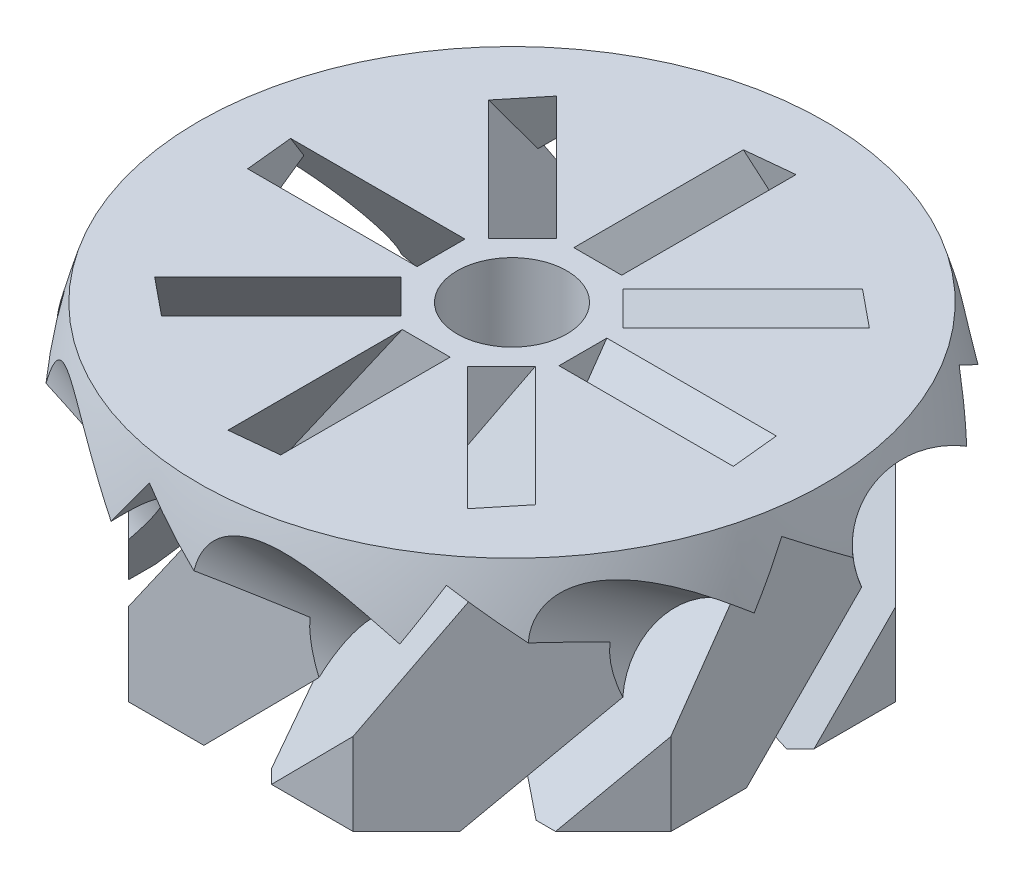
from build123d import *

# Parameters (mm, degrees)
BOSS_EXTRUDE1_DEPTH      = 20
BOSS_EXTRUDE1_DEPTH_BACK = 14
SKETCH1_R                = 45
CUT_EXTRUDE1_DEPTH       = 5
CIRPATTERN1_COUNT        = 8
SKETCH14_W               = 28.71512873
SKETCH14_H               = 59.277326168
CUT_EXTRUDE2_DEPTH       = 77.076617289
CIRPATTERN2_COUNT        = 8
SKETCH15_R               = 9
CUT_EXTRUDE3_DEPTH       = 73.506990997
CIRPATTERN3_COUNT        = 8


with BuildPart() as part:
    # Sketch1 → Boss-Extrude1 (new, two sides: drawn at the far end of the back side and taken through both)
    with BuildSketch(Plane(origin=(0, 0, 0), x_dir=(1, 0, 0), z_dir=(0, 1, 0)).offset(-BOSS_EXTRUDE1_DEPTH_BACK)):
        Circle(SKETCH1_R)
    extrude(amount=BOSS_EXTRUDE1_DEPTH + BOSS_EXTRUDE1_DEPTH_BACK)

    # Sketch10 → Cut-Extrude1 (cut)
    with BuildSketch(Plane(origin=(12.080966495, 8.459183808, 0), x_dir=(-0.5735764363510444, 0.819152044288993, 0), z_dir=(0.819152044288993, 0.5735764363510444, 0))):
        Polygon((-16.033183814, -50.5), (5.716816186, -50.5), (5.716816186, -44), (9.841816186, -44), (9.841816186, -33), (26.841816186, -30), (26.841816186, -10), (-37.158183814, -10), (-37.158183814, -30), (-20.158183814, -33), (-20.158183814, -44), (-16.033183814, -44), align=None)
    cut_extrude1 = extrude(amount=-CUT_EXTRUDE1_DEPTH, mode=Mode.SUBTRACT)

    # CirPattern1: Cut-Extrude1 ×8 about axis
    cirpattern1_axis = Axis((0, 20, 0), (0, 1, 0))
    for i in range(1, CIRPATTERN1_COUNT):
        add(cut_extrude1.rotate(cirpattern1_axis, i * 360 / CIRPATTERN1_COUNT), mode=Mode.SUBTRACT)

    # Sketch12 → Cut-Revolve1 (revolve, cut)
    with BuildSketch(Plane.XY):
        Polygon((0, 20), (0, -14), (-32.939995203, -14), (-7, 5.937457079), (-7, 20), align=None)
        with BuildLine():
            Line((-45, 20), (-45, -14))
            ThreePointArc((-45, -14), (-43.743313887, 3.182840277), (-40, 20))
            Line((-40, 20), (-45, 20))
        make_face()
    revolve(axis=Axis((0, 20, 0), (0, -1, 0)), mode=Mode.SUBTRACT)

    # Sketch14 → Cut-Extrude2 (cut, through all)
    with BuildSketch(Plane(origin=(12.080966495, 8.459183808, 0), x_dir=(0, 0, 1), z_dir=(-0.819152044288993, -0.5735764363510444, 0))):
        with Locations((-48.98374765, -18.893938705)):
            Rectangle(SKETCH14_W, SKETCH14_H)
    cut_extrude2 = extrude(amount=CUT_EXTRUDE2_DEPTH, mode=Mode.SUBTRACT)

    # CirPattern2: Cut-Extrude2 ×8 about axis
    cirpattern2_axis = Axis((0, -14, 0), (0, 1, 0))
    for i in range(1, CIRPATTERN2_COUNT):
        add(cut_extrude2.rotate(cirpattern2_axis, i * 360 / CIRPATTERN2_COUNT), mode=Mode.SUBTRACT)

    # Sketch15 → Cut-Extrude3 (cut, through all)
    with BuildSketch(Plane(origin=(12.080966495, 8.459183808, 0), x_dir=(0, 0, 1), z_dir=(-0.819152044288993, -0.5735764363510444, 0))):
        with Locations((-39.708462126, -5.496750775)):
            Circle(SKETCH15_R)
    cut_extrude3 = extrude(amount=-CUT_EXTRUDE3_DEPTH, mode=Mode.SUBTRACT)

    # CirPattern3: Cut-Extrude3 ×8 about axis
    cirpattern3_axis = Axis((0, -14, 0), (0, 1, 0))
    for i in range(1, CIRPATTERN3_COUNT):
        add(cut_extrude3.rotate(cirpattern3_axis, i * 360 / CIRPATTERN3_COUNT), mode=Mode.SUBTRACT)


solid = part.part
